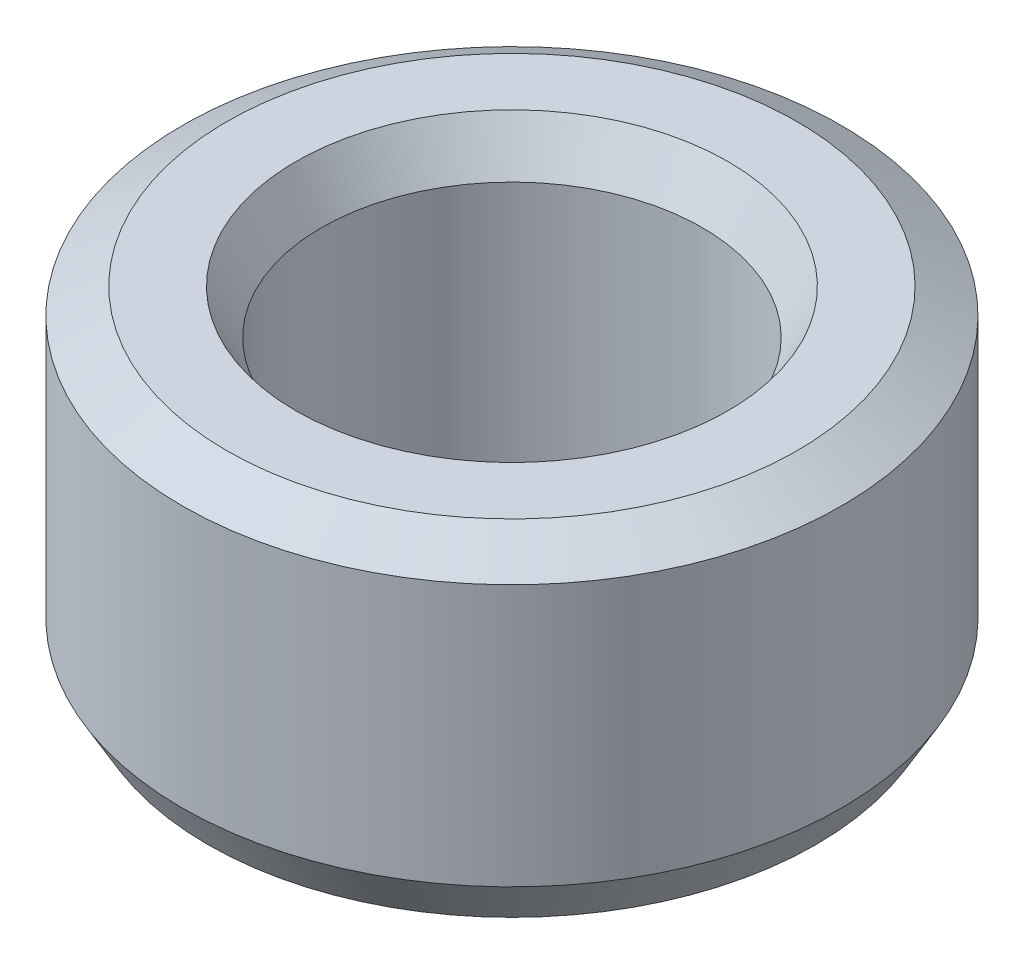
from build123d import *
from OCP.BRepFilletAPI import BRepFilletAPI_MakeChamfer

# Parameters (mm, degrees)
SKETCH1_R           = 27.5
BOSS_EXTRUDE1_DEPTH = 27.677293577
SKETCH2_R           = 15.888934132
CUT_EXTRUDE1_DEPTH  = 48.733977204
CHAMFER1_SIZE       = 2.134423968
CHAMFER1_SIZE2      = 3.71174707


with BuildPart() as part:
    # Sketch1 → Boss-Extrude1 (new body)
    with BuildSketch(Plane(origin=(0, 0, 0), x_dir=(1, 0, 0), z_dir=(0, 1, 0))):
        Circle(SKETCH1_R)
    extrude(amount=BOSS_EXTRUDE1_DEPTH)

    # Sketch2 → Cut-Extrude1 (cut, through all)
    with BuildSketch(Plane(origin=(0, 0, 0), x_dir=(1, 0, 0), z_dir=(0, 1, 0))):
        Circle(SKETCH2_R)
    extrude(amount=CUT_EXTRUDE1_DEPTH, mode=Mode.SUBTRACT)

    # Chamfer1: one chamfer whose edges measure the first distance from different faces: ONE call of the kernel's chamfer builder (chamfer() names one face for all edges)
    chamfer1_edges_1 = [part.edges().sort_by_distance(p)[0] for p in [
        (-15.888934132, 27.677293577, 0),
    ]]
    chamfer1_side_1 = [part.faces().sort_by_distance(p)[0] for p in [
        (-26.722182541, 27.677293577, 0),
    ]]
    chamfer1_edges_2 = [part.edges().sort_by_distance(p)[0] for p in [
        (-15.888934132, 0, 0),
    ]]
    chamfer1_side_2 = [part.faces().sort_by_distance(p)[0] for p in [
        (-15.888934132, 13.838646789, 0),
    ]]
    chamfer1_edges_3 = [part.edges().sort_by_distance(p)[0] for p in [
        (-27.5, 0, 0),
    ]]
    chamfer1_side_3 = [part.faces().sort_by_distance(p)[0] for p in [
        (-26.722182541, 0, 0),
    ]]
    chamfer1_edges_4 = [part.edges().sort_by_distance(p)[0] for p in [
        (-27.5, 27.677293577, 0),
    ]]
    chamfer1_side_4 = [part.faces().sort_by_distance(p)[0] for p in [
        (-27.5, 13.838646789, 0),
    ]]
    chamfer1 = BRepFilletAPI_MakeChamfer(part.part.solid().wrapped)
    for e in chamfer1_edges_1:
        chamfer1.Add(CHAMFER1_SIZE, CHAMFER1_SIZE2, e.wrapped, chamfer1_side_1[0].wrapped)  # the first distance lies on this face
    for e in chamfer1_edges_2:
        chamfer1.Add(CHAMFER1_SIZE, CHAMFER1_SIZE2, e.wrapped, chamfer1_side_2[0].wrapped)  # the first distance lies on this face
    for e in chamfer1_edges_3:
        chamfer1.Add(CHAMFER1_SIZE, CHAMFER1_SIZE2, e.wrapped, chamfer1_side_3[0].wrapped)  # the first distance lies on this face
    for e in chamfer1_edges_4:
        chamfer1.Add(CHAMFER1_SIZE, CHAMFER1_SIZE2, e.wrapped, chamfer1_side_4[0].wrapped)  # the first distance lies on this face
    add(Compound.cast(chamfer1.Shape()), mode=Mode.REPLACE)


solid = part.part
